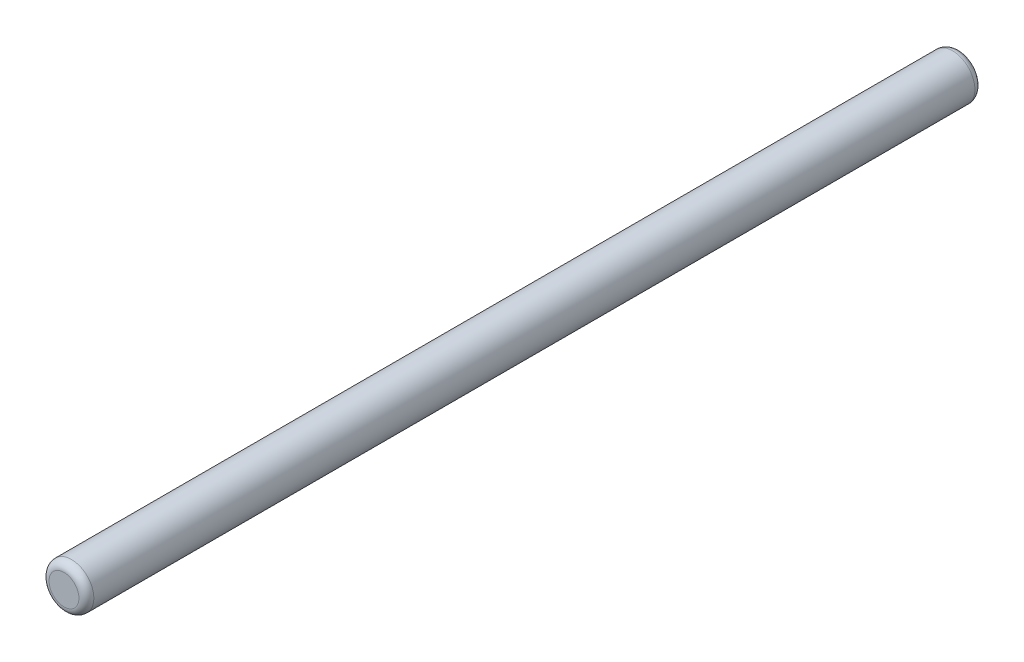
from build123d import *

# Parameters (mm, degrees)
SKIZZE1_R     = 3
BOLZEN_DEPTH  = 120
VERRUNDUNG1_R = 1


with BuildPart() as part:
    # Skizze1 → Bolzen (new body)
    with BuildSketch(Plane.XY):
        Circle(SKIZZE1_R)
    extrude(amount=BOLZEN_DEPTH)

    # Verrundung1
    verrundung1_edges = [part.edges().sort_by_distance(p)[0] for p in [
        (-3, 0, 0),
        (-3, 0, 120),
    ]]
    fillet(verrundung1_edges, radius=VERRUNDUNG1_R)


solid = part.part
